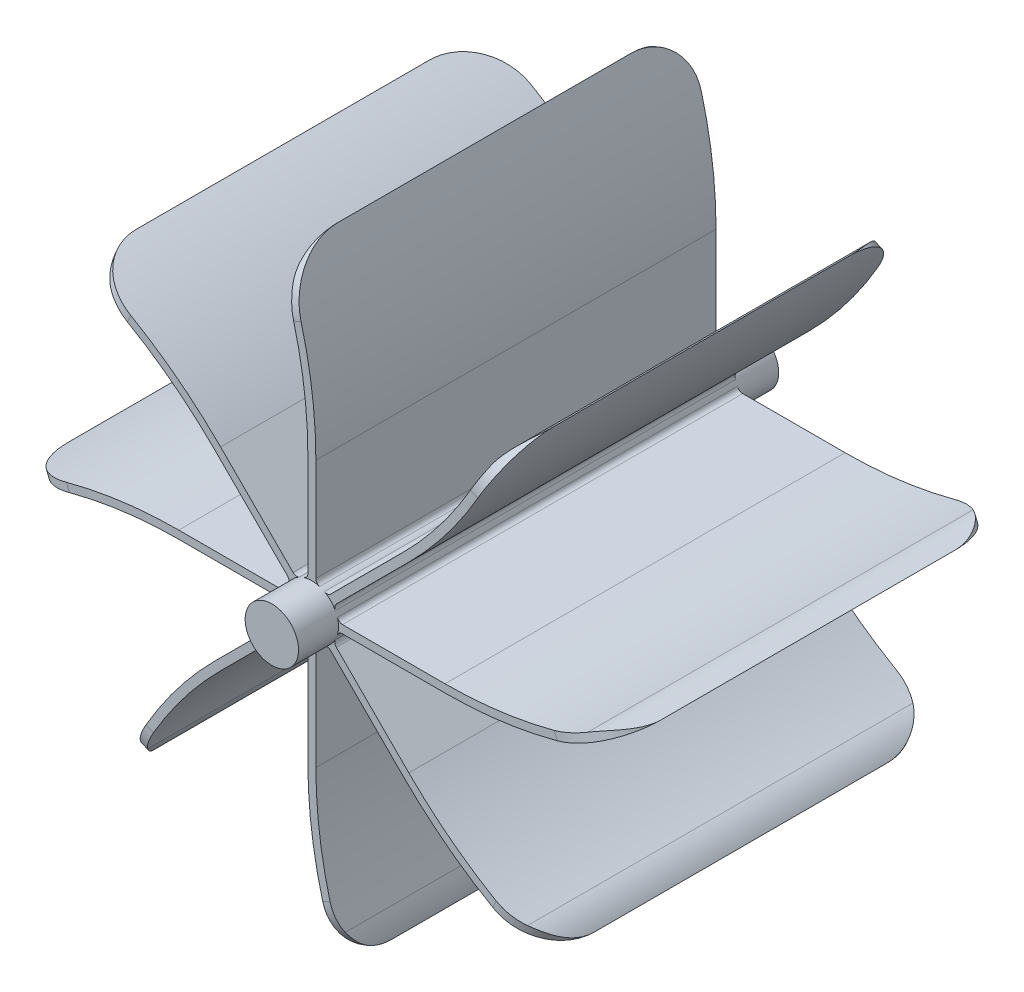
from build123d import *

# Parameters (mm, degrees)
SKETCH1_R                = 50
BOSS_EXTRUDE1_DEPTH      = 450
BOSS_EXTRUDE2_DEPTH      = 375
FILLET1_R                = 100
FILLET2_R                = 100
CIRPATTERN1_COUNT        = 8
FILLET1_OF_CIRPATTERN1_R = 100
FILLET2_OF_CIRPATTERN1_R = 100
FILLET3_R                = 10


with BuildPart() as part:
    # Sketch1 → Boss-Extrude1 (new, symmetric)
    with BuildSketch(Plane.XY):
        Circle(SKETCH1_R)
    extrude(amount=BOSS_EXTRUDE1_DEPTH, both=True)

    # Sketch2 → Boss-Extrude2 (add, symmetric)
    with BuildSketch(Plane.XY):
        with BuildLine():
            Line((-7.5, 49.434299833), (7.5, 49.434299833))
            Line((7.5, 49.434299833), (7.5, 249.434299833))
            ThreePointArc((7.5, 249.434299833), (-7.50675001, 405.112814578), (-51.974355755, 555.058253115))
            Line((-51.974355755, 555.058253115), (-65.88015129, 549.434299833))
            ThreePointArc((-65.88015129, 549.434299833), (-22.230658001, 402.248109799), (-7.5, 249.434299833))
            Line((-7.5, 249.434299833), (-7.5, 49.434299833))
        make_face()
    boss_extrude2 = extrude(amount=BOSS_EXTRUDE2_DEPTH, both=True)

    # Fillet1
    fillet1_edges = [part.edges().sort_by_distance(p)[0] for p in [
        (-58.927253523, 552.246276474, 375),
        (-58.927253523, 552.246276474, -375),
    ]]
    fillet(fillet1_edges, radius=FILLET1_R)

    # Fillet2
    # the kernel refuses this fillet: 100 mm, written as the material it takes off along each edge
    with BuildSketch(Plane(origin=(-65.88015129, 549.434299833, 398.018720877), x_dir=(0.3463122594885401, -0.9381192988783155, 0), z_dir=(0, 0, -1))) as fillet2_piece_1:
        with BuildLine():
            CenterArc((52.282956373, -99.952696294), FILLET2_R, 91.762391278, 30.069682716)
            Line((-0.460191638, -14.992939127), (-1.515054598, -13.293743983))
            ThreePointArc((-1.515054598, -13.293743983), (-2.229154369, -7.435110678), (-1.99905855, 0.061358885))
            Line((-1.99905855, 0.061358885), (0.06150936, 1.999053926))
            ThreePointArc((0.06150936, 1.999053926), (24.603744175, 1.621570352), (49.14597899, 1.999053926))
            Line((49.14597899, 1.999053926), (49.207488351, 0))
        make_face()
    extrude(amount=796.037441753, mode=Mode.SUBTRACT)

    # CirPattern1: Boss-Extrude2 ×8 about axis
    cirpattern1_axis = Axis((0, 0, 0), (0, 0, 1))
    for i in range(1, CIRPATTERN1_COUNT):
        add(boss_extrude2.rotate(cirpattern1_axis, i * 360 / CIRPATTERN1_COUNT))

    # Fillet1 of CirPattern1
    fillet1_of_cirpattern1_edges = [part.edges().sort_by_distance(p)[0] for p in [
        (-432.164947542, 348.829226417, 375),
        (-432.164947542, 348.829226417, -375),
        (-552.246276474, -58.927253523, 375),
        (-552.246276474, -58.927253523, -375),
        (-348.829226417, -432.164947542, 375),
        (-348.829226417, -432.164947542, -375),
        (58.927253523, -552.246276474, 375),
        (58.927253523, -552.246276474, -375),
        (432.164947542, -348.829226417, 375),
        (432.164947542, -348.829226417, -375),
        (552.246276474, 58.927253523, 375),
        (552.246276474, 58.927253523, -375),
        (348.829226417, 432.164947542, 375),
        (348.829226417, 432.164947542, -375),
    ]]
    fillet(fillet1_of_cirpattern1_edges, radius=FILLET1_OF_CIRPATTERN1_R)

    # Fillet2 of CirPattern1
    # the kernel refuses this fillet: 100 mm, written as the material it takes off along each edge
    with BuildSketch(Plane(origin=(-435.093020952, 341.924417505, 398.018720877), x_dir=(0.9082302648912091, -0.4184707707064426, 0), z_dir=(0, 0, -1)), Plane(origin=(-549.434299833, -65.88015129, 398.018720877), x_dir=(0.938119298878315, 0.3463122594885411, 0), z_dir=(0, 0, -1)), Plane(origin=(-341.924417505, -435.093020952, 398.018720877), x_dir=(0.4184707707064459, 0.9082302648912075, 0), z_dir=(0, 0, -1)), Plane(origin=(65.88015129, -549.434299833, 398.018720877), x_dir=(-0.346312259488539, 0.9381192988783157, 0), z_dir=(0, 0, -1)), Plane(origin=(435.093020952, -341.924417505, 398.018720877), x_dir=(-0.9082302648912084, 0.41847077070644406, 0), z_dir=(0, 0, -1)), Plane(origin=(549.434299833, 65.88015129, 398.018720877), x_dir=(-0.9381192988783151, -0.3463122594885407, 0), z_dir=(0, 0, -1)), Plane(origin=(341.924417505, 435.093020952, 398.018720877), x_dir=(-0.4184707707064435, -0.9082302648912087, 0), z_dir=(0, 0, -1))) as fillet2_of_cirpattern1_piece_1:
        with BuildLine():
            CenterArc((52.282956373, -99.952696294), FILLET2_OF_CIRPATTERN1_R, 91.762391278, 30.069682716)
            Line((-0.460191638, -14.992939127), (-1.515054598, -13.293743983))
            ThreePointArc((-1.515054598, -13.293743983), (-2.229154369, -7.435110678), (-1.99905855, 0.061358885))
            Line((-1.99905855, 0.061358885), (0.06150936, 1.999053926))
            ThreePointArc((0.06150936, 1.999053926), (24.603744175, 1.621570352), (49.14597899, 1.999053926))
            Line((49.14597899, 1.999053926), (49.207488351, 0))
        make_face()
    extrude(amount=796.037441753, mode=Mode.SUBTRACT)

    # Fillet3
    fillet3_edges = [part.edges().sort_by_distance(p)[0] for p in [
        (40.258629494, -29.652027776, 0),
        (29.652027776, -40.258629494, 0),
        (49.434299833, 7.5, 0),
        (49.434299833, -7.5, 0),
        (29.652027776, 40.258629494, 0),
        (40.258629494, 29.652027776, 0),
        (-40.258629494, 29.652027776, 0),
        (-29.652027776, 40.258629494, 0),
        (-49.434299833, -7.5, 0),
        (-49.434299833, 7.5, 0),
        (-29.652027776, -40.258629494, 0),
        (-40.258629494, -29.652027776, 0),
        (-7.5, 49.434299833, 0),
        (7.5, -49.434299833, 0),
        (-7.5, -49.434299833, 0),
        (7.5, 49.434299833, 0),
    ]]
    fillet(fillet3_edges, radius=FILLET3_R)


solid = part.part
